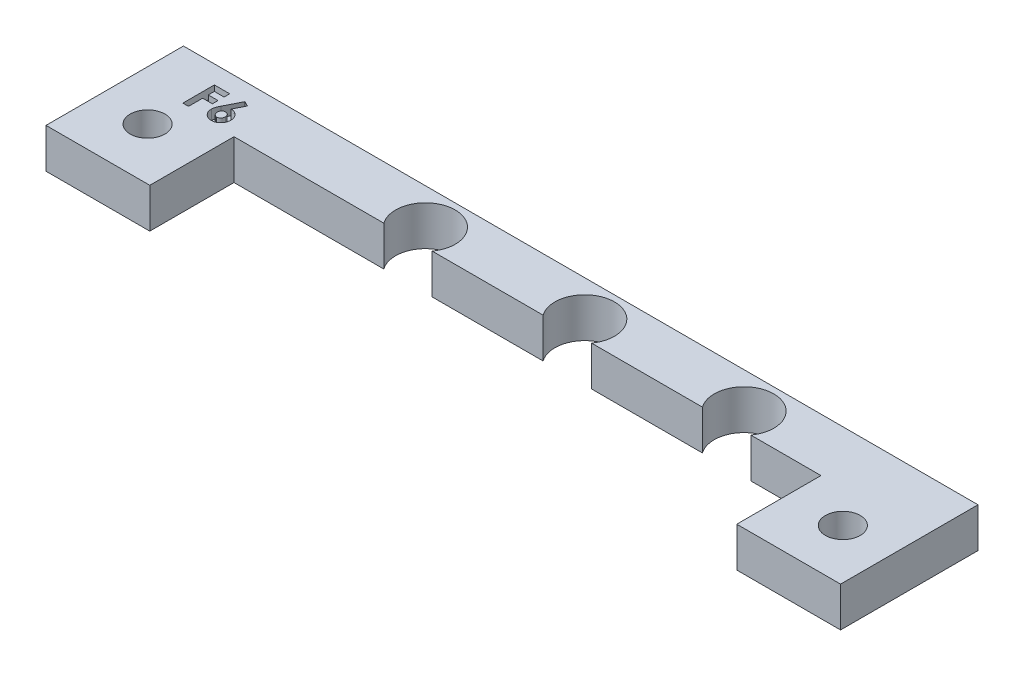
from build123d import *

# Parameters (mm, degrees)
BOSS_EXTRUDE1_OUTLINE_R = 1.75
BOSS_EXTRUDE1_DEPTH     = 4
CUT_EXTRUDE1_DEPTH      = 1


# Read off the part's stored shape, not the designer's step: Boss-Extrude1
with BuildPart() as part:
    # Boss-Extrude1 outline → Boss-Extrude1 (new body)
    with BuildSketch(Plane(origin=(0, 0, 0), x_dir=(1, 0, 0), z_dir=(0, 1, 0))):
        with BuildLine():
            Line((25.086474615, -10.33744254), (36.25307775, -10.33744254))
            ThreePointArc((36.25307775, -10.33744254), (38.689776183, -5.587442326), (41.126474615, -10.33744254))
            Line((41.126474615, -10.33744254), (48.189776182, -10.33744254))
            Line((48.189776182, -10.33744254), (48.189776182, -18.81631662))
            Line((48.189776182, -18.81631662), (58.639776182, -18.81631662))
            Line((58.639776182, -18.81631662), (58.639776182, -4.977921711))
            Line((58.639776182, -4.977921711), (-21.360223818, -4.977921711))
            Line((-21.360223818, -4.977921711), (-21.360223818, -18.81631662))
            Line((-21.360223818, -18.81631662), (-10.910223818, -18.81631662))
            Line((-10.910223818, -18.81631662), (-10.910223818, -10.33744254))
            Line((-10.910223818, -10.33744254), (4.17307775, -10.33744254))
            ThreePointArc((4.17307775, -10.33744254), (6.609776182, -5.587442326), (9.046474615, -10.33744254))
            Line((9.046474615, -10.33744254), (20.21307775, -10.33744254))
            ThreePointArc((20.21307775, -10.33744254), (22.649776182, -5.587442326), (25.086474615, -10.33744254))
        make_face()
        with Locations((-16.360223818, -13.587442433)):
            Circle(BOSS_EXTRUDE1_OUTLINE_R, mode=Mode.SUBTRACT)
        with Locations((53.639776182, -13.587442433)):
            Circle(BOSS_EXTRUDE1_OUTLINE_R, mode=Mode.SUBTRACT)
    extrude(amount=BOSS_EXTRUDE1_DEPTH)

    # Sketch2 → Cut-Extrude1 (cut)
    # profile 1 of 2: a face of its own
    with BuildSketch(Plane(origin=(0, 4, 0), x_dir=(1, 0, 0), z_dir=(0, 1, 0))):
        Polygon((-16.41198232, -6.812466594), (-14.865187448, -6.812466594), (-14.865187448, -7.382338389), (-15.842110525, -7.382338389), (-15.842110525, -7.992915312), (-14.865187448, -7.992915312), (-14.865187448, -8.562787107), (-15.842110525, -8.562787107), (-15.842110525, -9.987466594), (-16.41198232, -9.987466594), align=None)
    # profile 2 of 2: a face of its own
    with BuildSketch(Plane(origin=(0, 4, 0), x_dir=(1, 0, 0), z_dir=(0, 1, 0))):
        with BuildLine():
            Line((-13.412523186, -6.731056337), (-12.907525189, -6.987371442))
            Line((-12.907525189, -6.987371442), (-13.460860525, -8.074325568))
            add(Edge.make_bspline(
                [(-13.460860525, -8.074325568), (-13.428168252, -8.075158914), (-13.363985411, -8.076794974), (-13.269480346, -8.090388716), (-13.179110672, -8.113598896), (-13.09179585, -8.144481034), (-13.008800475, -8.185943305), (-12.928789535, -8.235267944), (-12.853832504, -8.295423778), (-12.782210807, -8.362073474), (-12.717085558, -8.435911696), (-12.660512768, -8.515253227), (-12.611210579, -8.59816766), (-12.572885042, -8.686509995), (-12.541970388, -8.778815858), (-12.519664104, -8.875454234), (-12.506937745, -8.976704968), (-12.505183204, -9.045489177), (-12.504290013, -9.080505456)],
                knots=[0, 0, 0, 0, 1.013672955, 1.990085268, 2.953345895, 3.903887042, 4.856677135, 5.825509993, 6.813434118, 7.832212698, 8.85718992, 9.860832204, 10.8510077, 11.84312444, 12.841215551, 13.86684641, 14.914066156, 16, 16, 16, 16], degree=3))
            add(Edge.make_bspline(
                [(-12.504290013, -9.080505456), (-12.505127007, -9.114259025), (-12.506781387, -9.180975356), (-12.520457023, -9.278964679), (-12.54255757, -9.372979704), (-12.57414369, -9.462832672), (-12.614292202, -9.548962785), (-12.663391114, -9.631319503), (-12.721847604, -9.7092874), (-12.78815132, -9.782452193), (-12.860632718, -9.849142442), (-12.937032061, -9.908420617), (-13.017996745, -9.957386638), (-13.101996444, -9.998739592), (-13.190577642, -10.029597853), (-13.28241472, -10.052890494), (-13.378204103, -10.06633136), (-13.443223482, -10.068021564), (-13.476124948, -10.06887685)],
                knots=[0, 0, 0, 0, 1.049934834, 2.075270938, 3.072134561, 4.05064612, 5.033440221, 6.024524368, 7.028587226, 8.060776465, 9.092543989, 10.090062252, 11.064205434, 12.031961459, 12.998029633, 13.977230324, 14.976426867, 16, 16, 16, 16], degree=3))
            add(Edge.make_bspline(
                [(-13.476124948, -10.06887685), (-13.510529884, -10.068174962), (-13.578182536, -10.066794794), (-13.677175296, -10.051340548), (-13.772117873, -10.028076335), (-13.862476674, -9.994858992), (-13.948813614, -9.952563006), (-14.03011223, -9.900225978), (-14.107057351, -9.838425045), (-14.17882863, -9.768550629), (-14.243489203, -9.692012768), (-14.30116103, -9.61254654), (-14.349951471, -9.530027246), (-14.389446195, -9.444543116), (-14.420260894, -9.356366547), (-14.44170164, -9.265330188), (-14.455672265, -9.171675513), (-14.457310002, -9.108116151), (-14.458136166, -9.076053333)],
                knots=[0, 0, 0, 0, 1.063775006, 2.091769615, 3.092589432, 4.084662827, 5.064601646, 6.061867366, 7.070035304, 8.113879863, 9.156342271, 10.166834137, 11.149076039, 12.117706134, 13.076241869, 14.034148791, 15.008317125, 16, 16, 16, 16], degree=3))
            add(Edge.make_bspline(
                [(-14.458136166, -9.076053333), (-14.457699638, -9.05122443), (-14.45682415, -9.001428418), (-14.448026022, -8.926861595), (-14.434649776, -8.852099041), (-14.419144957, -8.789012031), (-14.40317966, -8.735665362), (-14.387110466, -8.690519517), (-14.367196241, -8.640417501), (-14.344431332, -8.585231374), (-14.318099865, -8.525027523), (-14.288339392, -8.45997005), (-14.255075822, -8.38956629), (-14.231354315, -8.341209808), (-14.218993538, -8.316012267)],
                knots=[0, 0, 0, 0, 1.110454016, 2.227089276, 3.35462975, 4.507227546, 5.131400587, 5.845402449, 6.650387134, 7.543487832, 8.516250726, 9.590168902, 10.744287919, 12, 12, 12, 12], degree=3))
            Line((-14.218993538, -8.316012267), (-13.412523186, -6.731056337))
        make_face()
        with BuildLine():
            add(Edge.make_bspline(
                [(-13.488845301, -8.603492235), (-13.516189484, -8.604746455), (-13.569698461, -8.607200799), (-13.645780224, -8.632903881), (-13.71514953, -8.67322562), (-13.775279703, -8.729381439), (-13.825573059, -8.796489848), (-13.862530382, -8.873035953), (-13.884762266, -8.957998267), (-13.887072017, -9.0174025), (-13.888264372, -9.048068557)],
                knots=[0, 0, 0, 0, 0.981744412, 1.921144944, 2.858899012, 3.85339082, 4.86292663, 5.863643845, 6.897155691, 8, 8, 8, 8], degree=3))
            add(Edge.make_bspline(
                [(-13.888264372, -9.048068557), (-13.886852586, -9.078744826), (-13.884106568, -9.138412221), (-13.861038737, -9.224183527), (-13.823269539, -9.302467905), (-13.770300647, -9.370465646), (-13.708115929, -9.426909036), (-13.639160453, -9.468651622), (-13.56458442, -9.494295462), (-13.512998357, -9.497424351), (-13.486937248, -9.499005055)],
                knots=[0, 0, 0, 0, 1.098279937, 2.136227893, 3.159405121, 4.194678092, 5.206500211, 6.154139736, 7.067477469, 8, 8, 8, 8], degree=3))
            add(Edge.make_bspline(
                [(-13.486937248, -9.499005055), (-13.459413771, -9.497396198), (-13.405435452, -9.494240948), (-13.327568188, -9.469676154), (-13.256435974, -9.428632893), (-13.193541338, -9.372370211), (-13.13951604, -9.305148416), (-13.102135992, -9.226404206), (-13.078001724, -9.140013833), (-13.075470478, -9.079404145), (-13.074161807, -9.048068557)],
                knots=[0, 0, 0, 0, 0.96921794, 1.900804717, 2.848419905, 3.844199796, 4.861108892, 5.867439427, 6.897452859, 8, 8, 8, 8], degree=3))
            add(Edge.make_bspline(
                [(-13.074161807, -9.048068557), (-13.075652622, -9.017420405), (-13.078539758, -8.95806668), (-13.100225571, -8.872706338), (-13.138944126, -8.79645527), (-13.19037541, -8.729104426), (-13.252574944, -8.672973647), (-13.324720551, -8.632585891), (-13.404277856, -8.607246336), (-13.460245153, -8.604761847), (-13.488845301, -8.603492235)],
                knots=[0, 0, 0, 0, 1.083229974, 2.097801324, 3.086792542, 4.086858909, 5.079819718, 6.026392613, 6.991456328, 8, 8, 8, 8], degree=3))
        make_face(mode=Mode.SUBTRACT)
    extrude(amount=-CUT_EXTRUDE1_DEPTH, mode=Mode.SUBTRACT)


solid = part.part
